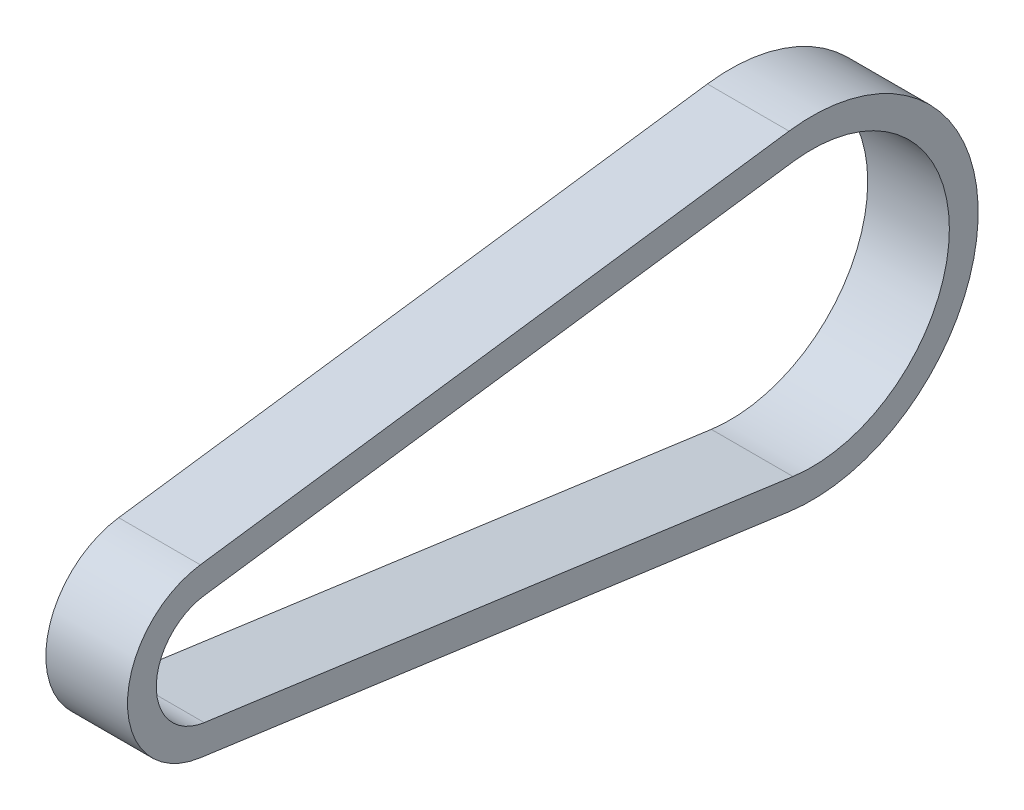
from build123d import *

# Parameters (mm, degrees)
BOSS_EXTRUDE1_DEPTH = 4.5


with BuildPart() as part:
    # Sketch1 → Boss-Extrude1 (new, symmetric)
    with BuildSketch(Plane(origin=(0, 0, 0), x_dir=(0, 0, -1), z_dir=(1, 0, 0))):
        with BuildLine():
            Line((-1.271219461, 9.211638628), (63.619338828, 18.16662958))
            ThreePointArc((63.619338828, 18.16662958), (84.46516, 0), (63.619338828, -18.16662958))
            Line((63.619338828, -18.16662958), (-1.271219461, -9.211638628))
            ThreePointArc((-1.271219461, -9.211638628), (-9.29894, 0), (-1.271219461, 9.211638628))
        make_face()
        with BuildLine():
            Line((-0.8371784, 6.066446526), (64.053379889, 15.021437478))
            ThreePointArc((64.053379889, 15.021437478), (81.29016, 0), (64.053379889, -15.021437478))
            Line((64.053379889, -15.021437478), (-0.8371784, -6.066446526))
            ThreePointArc((-0.8371784, -6.066446526), (-6.12394, 0), (-0.8371784, 6.066446526))
        make_face(mode=Mode.SUBTRACT)
    extrude(amount=BOSS_EXTRUDE1_DEPTH, both=True)


solid = part.part
